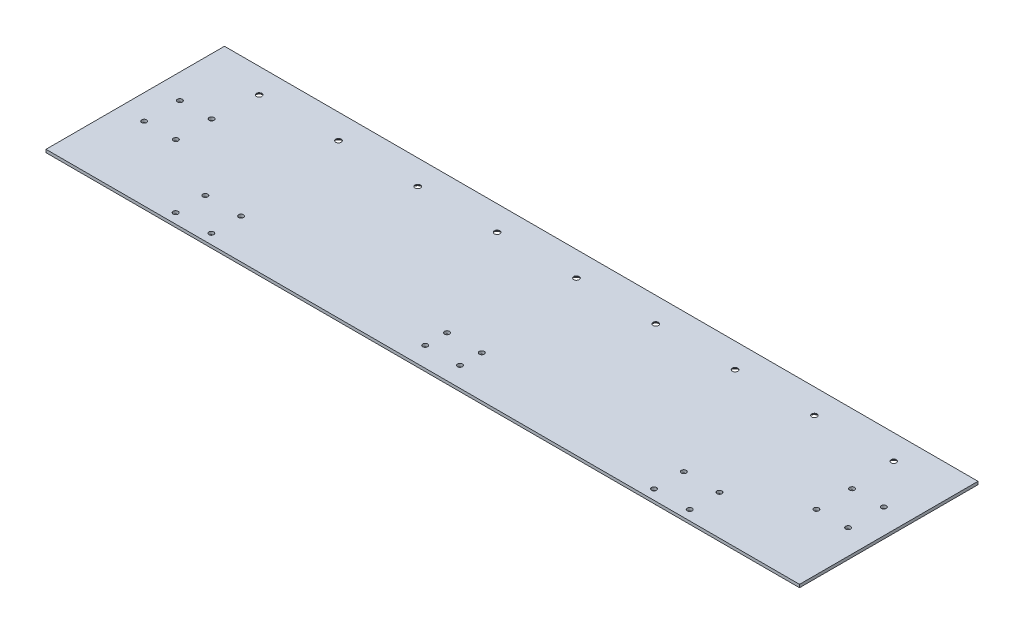
from build123d import *

# Parameters (mm, degrees)
SKETCH1_W                                    = 760
SKETCH1_H                                    = 180
BOSS_EXTRUDE1_DEPTH                          = 3
CSK_FOR_M5_COUNTERSUNK_FLAT_HEAD_SCR_2_COUNT = 2
CSK_FOR_M5_COUNTERSUNK_FLAT_HEAD_SCR_2_PITCH = 80
CSK_FOR_M5_COUNTERSUNK_FLAT_HEAD_SCR_3_COUNT = 2
CSK_FOR_M5_COUNTERSUNK_FLAT_HEAD_SCR_3_PITCH = 160
CSK_FOR_M5_COUNTERSUNK_FLAT_HEAD_SCR_4_COUNT = 2
CSK_FOR_M5_COUNTERSUNK_FLAT_HEAD_SCR_4_PITCH = 240
CSK_FOR_M5_COUNTERSUNK_FLAT_HEAD_SCR_5_COUNT = 2
CSK_FOR_M5_COUNTERSUNK_FLAT_HEAD_SCR_5_PITCH = 320
CSK_FOR_M5_COUNTERSUNK_FLAT_HEAD_SCR_6_COUNT = 2
CSK_FOR_M5_COUNTERSUNK_FLAT_HEAD_SCR_6_PITCH = 80
CSK_FOR_M5_COUNTERSUNK_FLAT_HEAD_SCR_7_COUNT = 2
CSK_FOR_M5_COUNTERSUNK_FLAT_HEAD_SCR_7_PITCH = 160
CSK_FOR_M5_COUNTERSUNK_FLAT_HEAD_SCR_8_COUNT = 2
CSK_FOR_M5_COUNTERSUNK_FLAT_HEAD_SCR_8_PITCH = 240
CSK_FOR_M5_COUNTERSUNK_FLAT_HEAD_SCR_9_COUNT = 2
CSK_FOR_M5_COUNTERSUNK_FLAT_HEAD_SCR_9_PITCH = 320
SKETCH4_R                                    = 2.5
CUT_EXTRUDE1_DEPTH                           = 10
SKETCH5_R                                    = 2.5
CUT_EXTRUDE2_DEPTH                           = 10
SKETCH6_R                                    = 2.5
CUT_EXTRUDE3_DEPTH                           = 8


with BuildPart() as part:
    # Sketch1 → Boss-Extrude1 (new body)
    with BuildSketch(Plane(origin=(0, 0, 0), x_dir=(1, 0, 0), z_dir=(0, 1, 0))):
        Rectangle(SKETCH1_W, SKETCH1_H)
    extrude(amount=BOSS_EXTRUDE1_DEPTH)

    # Sketch3 → CSK for M5 Countersunk Flat Head Screw1 (revolve, cut)
    with BuildSketch(Plane(origin=(0, 0, -65), x_dir=(0, 0, -1), z_dir=(1, 0, 0))):
        Polygon((0, 0), (0, 3), (2.75, 3), (2.75, 2.45), (5.2, 0), align=None)
    csk_for_m5_countersunk_flat_head_screw1 = revolve(axis=Axis((0, -6.35, -65), (0, 1, 0)), mode=Mode.SUBTRACT)

    # CSK for M5 Countersunk Flat Head Scr 2: CSK for M5 Countersunk Flat Head Screw1 ×2
    with Locations(*[(-i * CSK_FOR_M5_COUNTERSUNK_FLAT_HEAD_SCR_2_PITCH, 0, 0) for i in range(1, CSK_FOR_M5_COUNTERSUNK_FLAT_HEAD_SCR_2_COUNT)]):
        add(csk_for_m5_countersunk_flat_head_screw1, mode=Mode.SUBTRACT)

    # CSK for M5 Countersunk Flat Head Scr 3: CSK for M5 Countersunk Flat Head Screw1 ×2
    with Locations(*[(-i * CSK_FOR_M5_COUNTERSUNK_FLAT_HEAD_SCR_3_PITCH, 0, 0) for i in range(1, CSK_FOR_M5_COUNTERSUNK_FLAT_HEAD_SCR_3_COUNT)]):
        add(csk_for_m5_countersunk_flat_head_screw1, mode=Mode.SUBTRACT)

    # CSK for M5 Countersunk Flat Head Scr 4: CSK for M5 Countersunk Flat Head Screw1 ×2
    with Locations(*[(-i * CSK_FOR_M5_COUNTERSUNK_FLAT_HEAD_SCR_4_PITCH, 0, 0) for i in range(1, CSK_FOR_M5_COUNTERSUNK_FLAT_HEAD_SCR_4_COUNT)]):
        add(csk_for_m5_countersunk_flat_head_screw1, mode=Mode.SUBTRACT)

    # CSK for M5 Countersunk Flat Head Scr 5: CSK for M5 Countersunk Flat Head Screw1 ×2
    with Locations(*[(-i * CSK_FOR_M5_COUNTERSUNK_FLAT_HEAD_SCR_5_PITCH, 0, 0) for i in range(1, CSK_FOR_M5_COUNTERSUNK_FLAT_HEAD_SCR_5_COUNT)]):
        add(csk_for_m5_countersunk_flat_head_screw1, mode=Mode.SUBTRACT)

    # CSK for M5 Countersunk Flat Head Scr 6: CSK for M5 Countersunk Flat Head Screw1 ×2
    with Locations(*[(i * CSK_FOR_M5_COUNTERSUNK_FLAT_HEAD_SCR_6_PITCH, 0, 0) for i in range(1, CSK_FOR_M5_COUNTERSUNK_FLAT_HEAD_SCR_6_COUNT)]):
        add(csk_for_m5_countersunk_flat_head_screw1, mode=Mode.SUBTRACT)

    # CSK for M5 Countersunk Flat Head Scr 7: CSK for M5 Countersunk Flat Head Screw1 ×2
    with Locations(*[(i * CSK_FOR_M5_COUNTERSUNK_FLAT_HEAD_SCR_7_PITCH, 0, 0) for i in range(1, CSK_FOR_M5_COUNTERSUNK_FLAT_HEAD_SCR_7_COUNT)]):
        add(csk_for_m5_countersunk_flat_head_screw1, mode=Mode.SUBTRACT)

    # CSK for M5 Countersunk Flat Head Scr 8: CSK for M5 Countersunk Flat Head Screw1 ×2
    with Locations(*[(i * CSK_FOR_M5_COUNTERSUNK_FLAT_HEAD_SCR_8_PITCH, 0, 0) for i in range(1, CSK_FOR_M5_COUNTERSUNK_FLAT_HEAD_SCR_8_COUNT)]):
        add(csk_for_m5_countersunk_flat_head_screw1, mode=Mode.SUBTRACT)

    # CSK for M5 Countersunk Flat Head Scr 9: CSK for M5 Countersunk Flat Head Screw1 ×2
    with Locations(*[(i * CSK_FOR_M5_COUNTERSUNK_FLAT_HEAD_SCR_9_PITCH, 0, 0) for i in range(1, CSK_FOR_M5_COUNTERSUNK_FLAT_HEAD_SCR_9_COUNT)]):
        add(csk_for_m5_countersunk_flat_head_screw1, mode=Mode.SUBTRACT)

    # Sketch4 → Cut-Extrude1 (cut)
    with BuildSketch(Plane(origin=(0, 3, 0), x_dir=(1, 0, 0), z_dir=(0, 1, 0))):
        with Locations((-259.25, -80)):
            Circle(SKETCH4_R)
        with Locations((-223.25, -80)):
            Circle(SKETCH4_R)
        with Locations((-259.25, -50)):
            Circle(SKETCH4_R)
        with Locations((-223.25, -50)):
            Circle(SKETCH4_R)
        with Locations((259.25, -80)):
            Circle(SKETCH4_R)
        with Locations((223.25, -80)):
            Circle(SKETCH4_R)
        with Locations((223.25, -50)):
            Circle(SKETCH4_R)
        with Locations((259.25, -50)):
            Circle(SKETCH4_R)
    extrude(amount=-CUT_EXTRUDE1_DEPTH, mode=Mode.SUBTRACT)

    # Sketch5 → Cut-Extrude2 (cut)
    with BuildSketch(Plane(origin=(0, 3, 0), x_dir=(1, 0, 0), z_dir=(0, 1, 0))):
        with Locations((-355, 20)):
            Circle(SKETCH5_R)
        with Locations((-323, 20)):
            Circle(SKETCH5_R)
        with Locations((-355, -16)):
            Circle(SKETCH5_R)
        with Locations((-323, -16)):
            Circle(SKETCH5_R)
        with Locations((323, 20)):
            Circle(SKETCH5_R)
        with Locations((323, -16)):
            Circle(SKETCH5_R)
        with Locations((355, -16)):
            Circle(SKETCH5_R)
        with Locations((355, 20)):
            Circle(SKETCH5_R)
    extrude(amount=-CUT_EXTRUDE2_DEPTH, mode=Mode.SUBTRACT)

    # Sketch6 → Cut-Extrude3 (cut)
    with BuildSketch(Plane(origin=(0, 3, 0), x_dir=(1, 0, 0), z_dir=(0, 1, 0))):
        with Locations((-17.5, -48)):
            Circle(SKETCH6_R)
        with Locations((-17.5, -70)):
            Circle(SKETCH6_R)
        with Locations((17.5, -70)):
            Circle(SKETCH6_R)
        with Locations((17.5, -48)):
            Circle(SKETCH6_R)
    extrude(amount=-CUT_EXTRUDE3_DEPTH, mode=Mode.SUBTRACT)


solid = part.part
